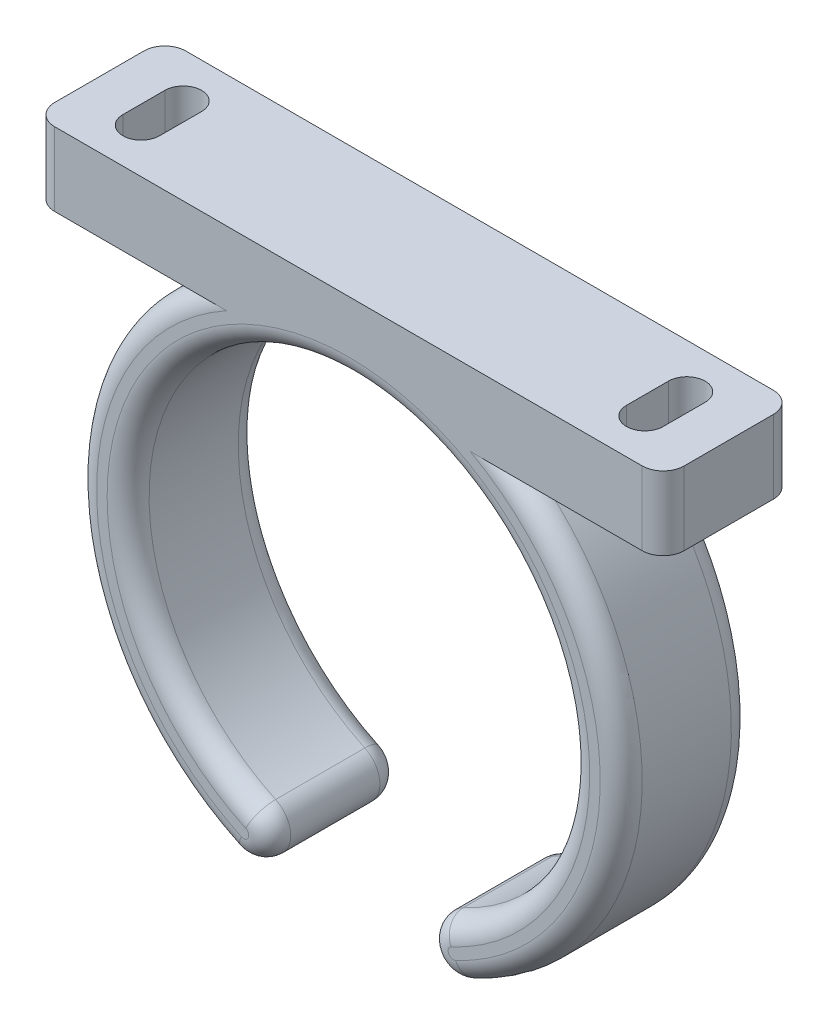
from build123d import *

# Parameters (mm, degrees)
SALIENTE_EXTRUIR1_DEPTH = 12.5
REDONDEO1_R             = 2
CORTAR_EXTRUIR1_REACH   = 57.32


with BuildPart() as part:
    # Croquis1 → Saliente-Extruir1 (new body)
    with BuildSketch(Plane.XY):
        with BuildLine():
            Line((-30, 28), (30, 28))
            Line((30, 28), (30, 21))
            Line((30, 21), (15.329709717, 21))
            ThreePointArc((15.329709717, 21), (25.881503097, -2.479475236), (11.063829787, -23.528528863))
            ThreePointArc((11.063829787, -23.528528863), (7.737641456, -22.330000105), (8.936170213, -19.003811774))
            ThreePointArc((8.936170213, -19.003811774), (0, 21), (-8.936170213, -19.003811774))
            ThreePointArc((-8.936170213, -19.003811774), (-7.737641456, -22.330000105), (-11.063829787, -23.528528863))
            ThreePointArc((-11.063829787, -23.528528863), (-25.881503097, -2.479475236), (-15.329709717, 21))
            Line((-15.329709717, 21), (-30, 21))
            Line((-30, 21), (-30, 28))
        make_face()
    extrude(amount=SALIENTE_EXTRUIR1_DEPTH)

    # Redondeo1
    # the kernel refuses this fillet: 2 mm, written as the material it takes off along each edge
    with BuildSketch(Plane(origin=(0, 0, 0), x_dir=(-0.4255319148936173, -0.9049434177930525, 0), z_dir=(0.9049434177930525, -0.4255319148936173, 0))) as redondeo1_piece_1_section:
        with BuildLine():
            CenterArc((26 - REDONDEO1_R, -REDONDEO1_R), REDONDEO1_R, 0, 90)
            Line((26 - REDONDEO1_R, 0), (26, 0))
            Line((26, 0), (26, -REDONDEO1_R))
        make_face()
    redondeo1_piece_1 = revolve(axis=Axis((0, 0, 0), (0, 0, -1)), revolution_arc=129.712854224, mode=Mode.PRIVATE)
    redondeo1_piece_1 = split(redondeo1_piece_1, bisect_by=Plane(origin=(-25.427272667, 21, 0.558955185), z_dir=(0, -1, 0)), keep=Keep.TOP, mode=Mode.PRIVATE)
    add(redondeo1_piece_1, mode=Mode.SUBTRACT)
    with BuildSketch(Plane(origin=(-30, 16, 0), x_dir=(0, 0, 1), z_dir=(0, 1, 0)), Plane(origin=(30, 33, 0), x_dir=(0, 0, 1), z_dir=(0, -1, 0))) as redondeo1_piece_2:
        with BuildLine():
            CenterArc((REDONDEO1_R, REDONDEO1_R), REDONDEO1_R, 180, 90)
            Line((0, REDONDEO1_R), (0, 0))
            Line((0, 0), (REDONDEO1_R, 0))
        make_face()
    extrude(amount=17, mode=Mode.SUBTRACT)
    with BuildSketch(Plane(origin=(0, 0, 0), x_dir=(0.4242438227476812, 0.9055479992029324, 0), z_dir=(-0.9055479992029324, 0.4242438227476812, 0))) as redondeo1_piece_3_section:
        with BuildLine():
            CenterArc((26 - REDONDEO1_R, -REDONDEO1_R), REDONDEO1_R, 0, 90)
            Line((26 - REDONDEO1_R, 0), (26, 0))
            Line((26, 0), (26, -REDONDEO1_R))
        make_face()
    redondeo1_piece_3 = revolve(axis=Axis((0, 0, 0), (0, 0, -1)), revolution_arc=129.712854224, mode=Mode.PRIVATE)
    redondeo1_piece_3 = split(redondeo1_piece_3, bisect_by=Plane(origin=(25.427272718, 21, 0.558955134), z_dir=(0, -1, 0)), keep=Keep.TOP, mode=Mode.PRIVATE)
    add(redondeo1_piece_3, mode=Mode.SUBTRACT)
    with BuildSketch(Plane(origin=(10, -21.266170318, 0), x_dir=(0.42553191489361814, -0.9049434177930521, 0), z_dir=(0.9049434177930521, 0.42553191489361814, 0))) as redondeo1_piece_4:
        with BuildLine():
            CenterArc((2.5 - REDONDEO1_R, -REDONDEO1_R), REDONDEO1_R, 0, 90)
            Line((2.5 - REDONDEO1_R, 0), (2.5, 0))
            Line((2.5, 0), (2.5, -REDONDEO1_R))
        make_face()
    revolve(axis=Axis((10, -21.266170318, 0), (0, 0, -1)), revolution_arc=180, mode=Mode.SUBTRACT)
    with BuildSketch(Plane(origin=(30, 33, 12.5), x_dir=(0, 0, -1), z_dir=(0, -1, 0)), Plane(origin=(-30, 16, 12.5), x_dir=(0, 0, -1), z_dir=(0, 1, 0))) as redondeo1_piece_5:
        with BuildLine():
            CenterArc((REDONDEO1_R, -REDONDEO1_R), REDONDEO1_R, 90, 90)
            Line((0, -REDONDEO1_R), (0, 0))
            Line((0, 0), (REDONDEO1_R, 0))
        make_face()
    extrude(amount=17, mode=Mode.SUBTRACT)
    with BuildSketch(Plane(origin=(0, 0, 12.5), x_dir=(-0.4255319148936173, -0.9049434177930525, 0), z_dir=(0.9049434177930525, -0.4255319148936173, 0))) as redondeo1_piece_6_section:
        with BuildLine():
            CenterArc((26 - REDONDEO1_R, REDONDEO1_R), REDONDEO1_R, 270, 90)
            Line((26 - REDONDEO1_R, 0), (26, 0))
            Line((26, 0), (26, REDONDEO1_R))
        make_face()
    redondeo1_piece_6 = revolve(axis=Axis((0, 0, 12.5), (0, 0, -1)), revolution_arc=129.712854224, mode=Mode.PRIVATE)
    redondeo1_piece_6 = split(redondeo1_piece_6, bisect_by=Plane(origin=(-25.427272667, 21, 11.941044815), z_dir=(0, -1, 0)), keep=Keep.TOP, mode=Mode.PRIVATE)
    add(redondeo1_piece_6, mode=Mode.SUBTRACT)
    with BuildSketch(Plane(origin=(-10, -21.266170318, 12.5), x_dir=(0.42553191489361525, 0.9049434177930535, 0), z_dir=(-0.9049434177930535, 0.42553191489361525, 0))) as redondeo1_piece_7:
        with BuildLine():
            CenterArc((2.5 - REDONDEO1_R, REDONDEO1_R), REDONDEO1_R, 270, 90)
            Line((2.5 - REDONDEO1_R, 0), (2.5, 0))
            Line((2.5, 0), (2.5, REDONDEO1_R))
        make_face()
    revolve(axis=Axis((-10, -21.266170318, 12.5), (0, 0, -1)), revolution_arc=180, mode=Mode.SUBTRACT)
    with BuildSketch(Plane(origin=(0, 0, 12.5), x_dir=(0.4255319148936173, -0.9049434177930525, 0), z_dir=(-0.9049434177930525, -0.4255319148936173, 0))) as redondeo1_piece_8:
        with BuildLine():
            CenterArc((21 + REDONDEO1_R, -REDONDEO1_R), REDONDEO1_R, 90, 90)
            Line((21 + REDONDEO1_R, 0), (21, 0))
            Line((21, 0), (21, -REDONDEO1_R))
        make_face()
    revolve(axis=Axis((0, 0, 12.5), (0, 0, 1)), revolution_arc=309.631326932, mode=Mode.SUBTRACT)
    with BuildSketch(Plane(origin=(10, -21.266170318, 12.5), x_dir=(0.42553191489361814, -0.9049434177930521, 0), z_dir=(0.9049434177930521, 0.42553191489361814, 0))) as redondeo1_piece_9:
        with BuildLine():
            CenterArc((2.5 - REDONDEO1_R, REDONDEO1_R), REDONDEO1_R, 270, 90)
            Line((2.5 - REDONDEO1_R, 0), (2.5, 0))
            Line((2.5, 0), (2.5, REDONDEO1_R))
        make_face()
    revolve(axis=Axis((10, -21.266170318, 12.5), (0, 0, -1)), revolution_arc=180, mode=Mode.SUBTRACT)
    with BuildSketch(Plane(origin=(0, 0, 12.5), x_dir=(0.4242438227476812, 0.9055479992029324, 0), z_dir=(-0.9055479992029324, 0.4242438227476812, 0))) as redondeo1_piece_10_section:
        with BuildLine():
            CenterArc((26 - REDONDEO1_R, REDONDEO1_R), REDONDEO1_R, 270, 90)
            Line((26 - REDONDEO1_R, 0), (26, 0))
            Line((26, 0), (26, REDONDEO1_R))
        make_face()
    redondeo1_piece_10 = revolve(axis=Axis((0, 0, 12.5), (0, 0, -1)), revolution_arc=129.712854224, mode=Mode.PRIVATE)
    redondeo1_piece_10 = split(redondeo1_piece_10, bisect_by=Plane(origin=(25.427272718, 21, 11.941044866), z_dir=(0, -1, 0)), keep=Keep.TOP, mode=Mode.PRIVATE)
    add(redondeo1_piece_10, mode=Mode.SUBTRACT)
    with BuildSketch(Plane(origin=(0, 0, 0), x_dir=(0.4255319148936173, -0.9049434177930525, 0), z_dir=(-0.9049434177930525, -0.4255319148936173, 0))) as redondeo1_piece_11:
        with BuildLine():
            CenterArc((21 + REDONDEO1_R, REDONDEO1_R), REDONDEO1_R, 180, 90)
            Line((21 + REDONDEO1_R, 0), (21, 0))
            Line((21, 0), (21, REDONDEO1_R))
        make_face()
    revolve(axis=Axis((0, 0, 0), (0, 0, 1)), revolution_arc=309.631326932, mode=Mode.SUBTRACT)
    with BuildSketch(Plane(origin=(-10, -21.266170318, 0), x_dir=(0.42553191489361525, 0.9049434177930535, 0), z_dir=(-0.9049434177930535, 0.42553191489361525, 0))) as redondeo1_piece_12:
        with BuildLine():
            CenterArc((2.5 - REDONDEO1_R, -REDONDEO1_R), REDONDEO1_R, 0, 90)
            Line((2.5 - REDONDEO1_R, 0), (2.5, 0))
            Line((2.5, 0), (2.5, -REDONDEO1_R))
        make_face()
    revolve(axis=Axis((-10, -21.266170318, 0), (0, 0, -1)), revolution_arc=180, mode=Mode.SUBTRACT)

    # Croquis3 → Cortar-Extruir1 (cut, up to next)
    with BuildSketch(Plane.XZ.offset(-21), mode=Mode.PRIVATE) as cortar_extruir1_sk1:
        with BuildLine():
            Line((-22.25, 8.25), (-22.25, 4.25))
            ThreePointArc((-22.25, 4.25), (-24, 2.5), (-25.75, 4.25))
            Line((-25.75, 4.25), (-25.75, 8.25))
            ThreePointArc((-25.75, 8.25), (-24, 10), (-22.25, 8.25))
        make_face()
    cortar_extruir1_tool1 = extrude(cortar_extruir1_sk1.sketch, amount=-CORTAR_EXTRUIR1_REACH, mode=Mode.PRIVATE) & part.part
    # Croquis3 → Cortar-Extruir1 (cut, up to next)
    with BuildSketch(Plane.XZ.offset(-21), mode=Mode.PRIVATE) as cortar_extruir1_sk2:
        with BuildLine():
            Line((25.75, 8.25), (25.75, 4.25))
            ThreePointArc((25.75, 4.25), (24, 2.5), (22.25, 4.25))
            Line((22.25, 4.25), (22.25, 8.25))
            ThreePointArc((22.25, 8.25), (24, 10), (25.75, 8.25))
        make_face()
    cortar_extruir1_tool2 = extrude(cortar_extruir1_sk2.sketch, amount=-CORTAR_EXTRUIR1_REACH, mode=Mode.PRIVATE) & part.part
    add(cortar_extruir1_tool1.solids().sort_by_distance((-24, 21, 6.25))[0], mode=Mode.SUBTRACT)
    add(cortar_extruir1_tool2.solids().sort_by_distance((24, 21, 6.25))[0], mode=Mode.SUBTRACT)


solid = part.part
